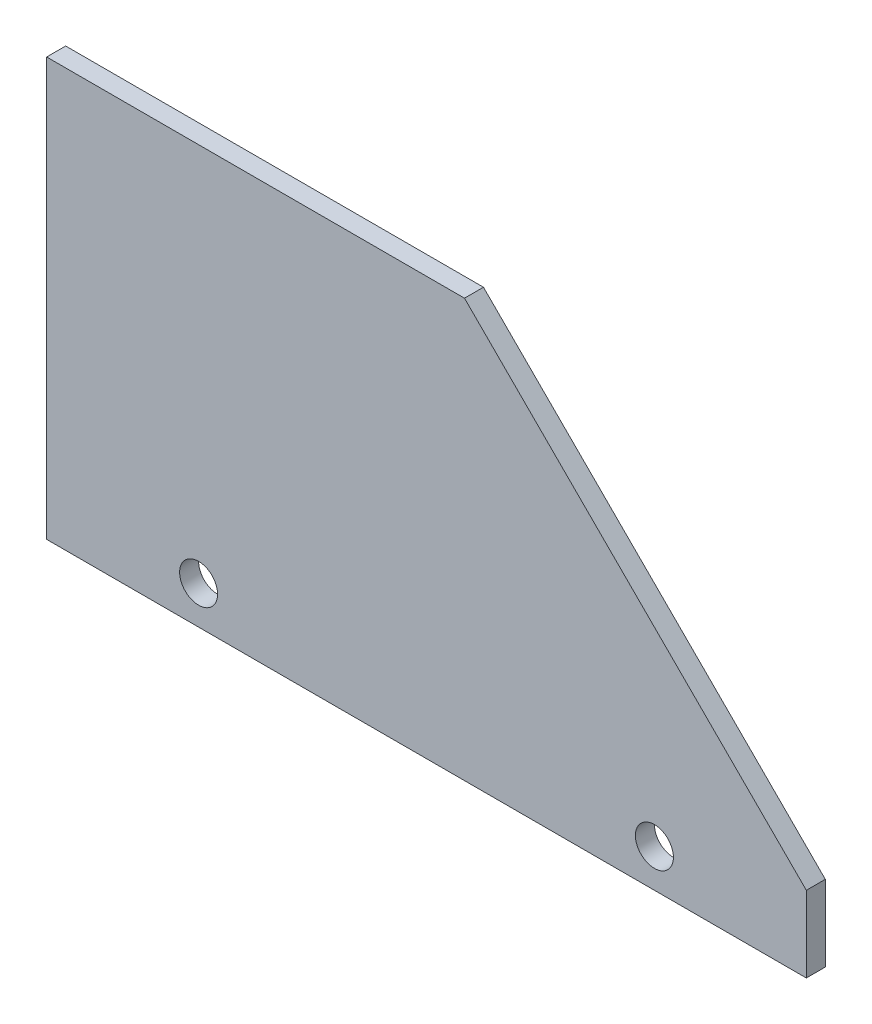
from build123d import *

# Parameters (mm, degrees)
BOSS_EXTRUDE1_DEPTH = 1.5875
SKETCH2_R           = 1.5875
CUT_EXTRUDE1_DEPTH  = 2.54
LPATTERN2_COUNT     = 2
LPATTERN2_PITCH     = 38.1


with BuildPart() as part:
    # Sketch1 → Boss-Extrude1 (new body)
    with BuildSketch(Plane.XY):
        Polygon((0, 0), (0, 34.925), (34.925, 34.925), (63.5, 6.35), (63.5, 0), align=None)
    extrude(amount=BOSS_EXTRUDE1_DEPTH)

    # Sketch2 → Cut-Extrude1 (cut)
    with BuildSketch(Plane.XY.offset(1.5875)):
        with Locations((12.7, 3.175)):
            Circle(SKETCH2_R)
    cut_extrude1 = extrude(amount=-CUT_EXTRUDE1_DEPTH, mode=Mode.SUBTRACT)

    # LPattern2: Cut-Extrude1 ×2
    with Locations(*[(i * LPATTERN2_PITCH, 0, 0) for i in range(1, LPATTERN2_COUNT)]):
        add(cut_extrude1, mode=Mode.SUBTRACT)


solid = part.part
